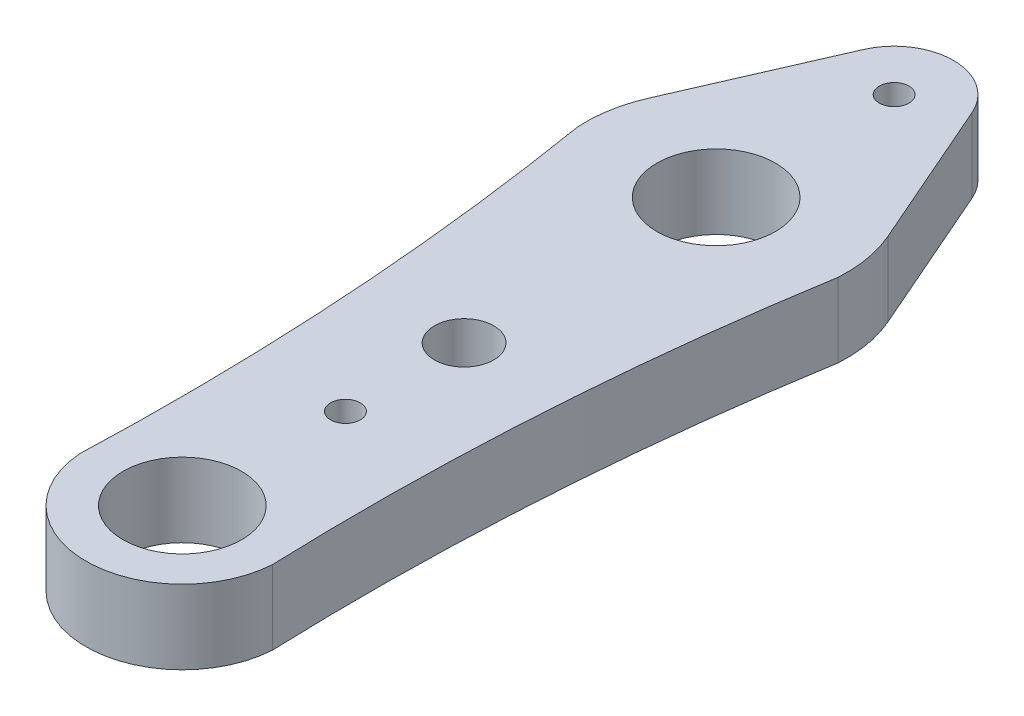
from build123d import *

# Parameters (mm, degrees)
SKETCH1_R           = 4
SKETCH1_R_2         = 1
SKETCH1_R_3         = 2
BOSS_EXTRUDE1_DEPTH = 5


with BuildPart() as part:
    # Sketch1 → Boss-Extrude1 (new body)
    with BuildSketch(Plane(origin=(0, 0, 0), x_dir=(1, 0, 0), z_dir=(0, 1, 0))):
        with BuildLine():
            Line((-3.666060556, 30.6), (-8.065333223, 20.52))
            ThreePointArc((-8.065333223, 20.52), (-8.667437744, 18.521684251), (-8.782021759, 16.437777778))
            ThreePointArc((-8.782021759, 16.437777778), (-8.64730319, 15.61122755), (-8.516431626, 14.784059485))
            ThreePointArc((-8.516431626, 14.784059485), (-6.724262557, -1.642204863), (-6.445963017, -18.163602496))
            ThreePointArc((-6.445963017, -18.163602496), (-6.465253257, -18.789475583), (-6.486720617, -19.415277778))
            ThreePointArc((-6.486720617, -19.415277778), (0, -25.5), (6.486720617, -19.415277778))
            ThreePointArc((6.486720617, -19.415277778), (6.465253257, -18.789475583), (6.445963017, -18.163602496))
            ThreePointArc((6.445963017, -18.163602496), (6.724262557, -1.642204863), (8.516431626, 14.784059485))
            ThreePointArc((8.516431626, 14.784059485), (8.64730319, 15.61122755), (8.782021759, 16.437777778))
            ThreePointArc((8.782021759, 16.437777778), (8.667437744, 18.521684251), (8.065333223, 20.52))
            Line((8.065333223, 20.52), (3.666060556, 30.6))
            ThreePointArc((3.666060556, 30.6), (0, 33), (-3.666060556, 30.6))
        make_face()
        with Locations((0, -19)):
            Circle(SKETCH1_R, mode=Mode.SUBTRACT)
        with Locations((0, -8)):
            Circle(SKETCH1_R_2, mode=Mode.SUBTRACT)
        Circle(SKETCH1_R_3, mode=Mode.SUBTRACT)
        with Locations((0, 17)):
            Circle(SKETCH1_R, mode=Mode.SUBTRACT)
        with Locations((0, 29)):
            Circle(SKETCH1_R_2, mode=Mode.SUBTRACT)
    extrude(amount=BOSS_EXTRUDE1_DEPTH)


solid = part.part
